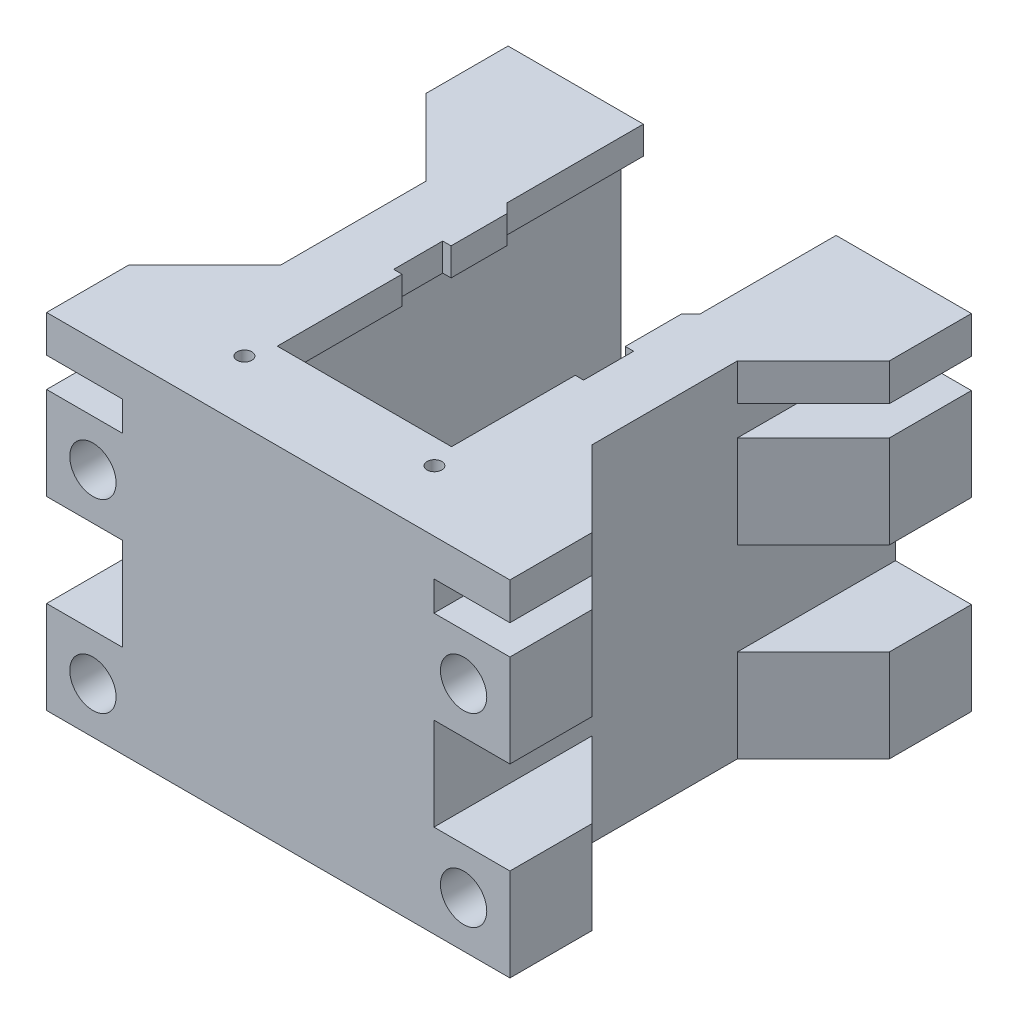
from build123d import *

# Parameters (mm, degrees)
SKETCH1_R                 = 0.8
BOSS_EXTRUDE2_DEPTH       = 2.4
BOSS_EXTRUDE4_DEPTH       = 34.2
BOSS_EXTRUDE7_OUTLINE_R   = 0.8
BOSS_EXTRUDE7_DEPTH       = 37.2
SKETCH1_10_R              = 0.8
CUT_EXTRUDE6_DEPTH        = 34.2
SKETCH1_11_R              = 0.8
BOSS_EXTRUDE8_DEPTH       = 2
BOSS_EXTRUDE9_START       = -49.8
BOSS_EXTRUDE9_OUTLINE_W   = 8.2
BOSS_EXTRUDE9_OUTLINE_H   = 10
BOSS_EXTRUDE9_OUTLINE_R   = 2.5
BOSS_EXTRUDE9_OUTLINE_H_2 = 4
BOSS_EXTRUDE9_DEPTH       = 49.8
BOSS_EXTRUDE10_START      = -44.4
SKETCH9_3_R               = 2.5
BOSS_EXTRUDE10_DEPTH      = 44.4
CUT_EXTRUDE7_START        = -5.4
SKETCH9_4_R               = 2.5
CUT_EXTRUDE7_DEPTH        = 5.4
CUT_EXTRUDE8_START        = -37.2
CUT_EXTRUDE8_DEPTH        = 37.2
BOSS_EXTRUDE12_START      = -3
BOSS_EXTRUDE12_DEPTH      = 3


# Read off the part's stored shape, not the designer's step: Boss-Extrude7, Boss-Extrude9
with BuildPart() as part:
    # Sketch1 → Boss-Extrude2 (new body)
    with BuildSketch(Plane(origin=(0, 0, 0), x_dir=(1, 0, 0), z_dir=(0, 1, 0))):
        Polygon((-10.4, 16.242178951), (-10.4, 30.95), (-16.8, 30.95), (-16.8, -18.85), (16.8, -18.85), (16.8, 30.95), (10.4, 30.95), (10.4, 16.242178951), (7.2, 13.042178951), (7.2, -14.85), (-7.2, -14.85), (-7.2, 13.042178951), align=None)
        with Locations(Location((-10.25, -8.45, 0), (0, 0, 270))):
            Circle(SKETCH1_R, mode=Mode.SUBTRACT)
        with Locations(Location((-10.25, 12.25, 0), (0, 0, 270))):
            Circle(SKETCH1_R, mode=Mode.SUBTRACT)
        with Locations(Location((-10.25, -12.25, 0), (0, 0, 270))):
            Circle(SKETCH1_R, mode=Mode.SUBTRACT)
        with Locations(Location((10.25, -8.45, 0), (0, 0, 270))):
            Circle(SKETCH1_R, mode=Mode.SUBTRACT)
        with Locations(Location((10.25, -12.25, 0), (0, 0, 270))):
            Circle(SKETCH1_R, mode=Mode.SUBTRACT)
        with Locations(Location((10.25, 12.25, 0), (0, 0, 270))):
            Circle(SKETCH1_R, mode=Mode.SUBTRACT)
    extrude(amount=BOSS_EXTRUDE2_DEPTH)

    # Sketch1<6> → Boss-Extrude4 (add)
    with BuildSketch(Plane(origin=(0, 0, 0), x_dir=(1, 0, 0), z_dir=(0, 1, 0))):
        Polygon((-12.8, -14.85), (-12.8, 30.95), (-16.8, 30.95), (-16.8, -18.85), (16.8, -18.85), (16.8, 30.95), (12.8, 30.95), (12.8, -14.85), align=None)
    extrude(amount=BOSS_EXTRUDE4_DEPTH)

    # Boss-Extrude7 outline → Boss-Extrude7 (add)
    with BuildSketch(Plane(origin=(0, 0, 0), x_dir=(1, 0, 0), z_dir=(0, 1, 0))):
        Polygon((16.8, -18.85), (16.8, 30.95), (10.4, 30.95), (10.4, 16.242178951), (9.4, 15.242178951), (9.4, 9.2), (10.3, 9.2), (10.3, 3.8), (9.4, 3.8), (9.4, -9.55), (-9.4, -9.55), (-9.4, 3.9), (-10.3, 3.9), (-10.3, 9.2), (-9.4, 9.2), (-9.4, 15.242178951), (-10.4, 16.242178951), (-10.4, 30.95), (-16.8, 30.95), (-16.8, -18.85), align=None)
        with Locations((-10.25, 12.25)):
            Circle(BOSS_EXTRUDE7_OUTLINE_R, mode=Mode.SUBTRACT)
        with Locations((-10.25, -12.25)):
            Circle(BOSS_EXTRUDE7_OUTLINE_R, mode=Mode.SUBTRACT)
        with Locations((10.25, 12.25)):
            Circle(BOSS_EXTRUDE7_OUTLINE_R, mode=Mode.SUBTRACT)
        with Locations((10.25, -12.25)):
            Circle(BOSS_EXTRUDE7_OUTLINE_R, mode=Mode.SUBTRACT)
    extrude(amount=BOSS_EXTRUDE7_DEPTH)

    # Sketch1<10> → Cut-Extrude6 (cut)
    with BuildSketch(Plane(origin=(0, 0, 0), x_dir=(1, 0, 0), z_dir=(0, 1, 0))):
        Polygon((-10.4, 16.242178951), (-10.4, 30.95), (-12.8, 30.95), (-12.8, -14.85), (12.8, -14.85), (12.8, 30.95), (10.4, 30.95), (10.4, 16.242178951), (7.2, 13.042178951), (7.2, -9.55), (-7.2, -9.55), (-7.2, 13.042178951), align=None)
        with Locations(Location((-10.25, 12.25, 0), (0, 0, 270))):
            Circle(SKETCH1_10_R, mode=Mode.SUBTRACT)
        with Locations(Location((-10.25, -12.25, 0), (0, 0, 270))):
            Circle(SKETCH1_10_R, mode=Mode.SUBTRACT)
        with Locations(Location((10.25, -12.25, 0), (0, 0, 270))):
            Circle(SKETCH1_10_R, mode=Mode.SUBTRACT)
        with Locations(Location((10.25, 12.25, 0), (0, 0, 270))):
            Circle(SKETCH1_10_R, mode=Mode.SUBTRACT)
    extrude(amount=CUT_EXTRUDE6_DEPTH, mode=Mode.SUBTRACT)

    # Sketch1<11> → Boss-Extrude8 (add)
    # profile 1 of 2: a face of its own
    with BuildSketch(Plane(origin=(0, 0, 0), x_dir=(1, 0, 0), z_dir=(0, 1, 0))):
        Polygon((-10.4, 16.242178951), (-10.4, 30.95), (-12.8, 30.95), (-12.8, -14.85), (-7.2, -14.85), (-7.2, 13.042178951), align=None)
        with Locations(Location((-10.25, -8.45, 0), (0, 0, 270))):
            Circle(SKETCH1_11_R, mode=Mode.SUBTRACT)
        with Locations(Location((-10.25, 12.25, 0), (0, 0, 270))):
            Circle(SKETCH1_11_R, mode=Mode.SUBTRACT)
    # profile 2 of 2: a face of its own
    with BuildSketch(Plane(origin=(0, 0, 0), x_dir=(1, 0, 0), z_dir=(0, 1, 0))):
        Polygon((7.2, -14.85), (12.8, -14.85), (12.8, 30.95), (10.4, 30.95), (10.4, 16.242178951), (7.2, 13.042178951), align=None)
        with Locations(Location((10.25, -8.45, 0), (0, 0, 270))):
            Circle(SKETCH1_11_R, mode=Mode.SUBTRACT)
        with Locations(Location((10.25, 12.25, 0), (0, 0, 270))):
            Circle(SKETCH1_11_R, mode=Mode.SUBTRACT)
    extrude(amount=BOSS_EXTRUDE8_DEPTH)

    # Boss-Extrude9 outline → Boss-Extrude9 (add)
    # profile 1 of 6: a face of its own
    with BuildSketch(Plane.XY.offset(18.85).offset(BOSS_EXTRUDE9_START)):
        with Locations((20.9, 5)):
            Rectangle(BOSS_EXTRUDE9_OUTLINE_W, BOSS_EXTRUDE9_OUTLINE_H)
        with Locations((20, 5)):
            Circle(BOSS_EXTRUDE9_OUTLINE_R, mode=Mode.SUBTRACT)
    # profile 2 of 6: a face of its own
    with BuildSketch(Plane.XY.offset(18.85).offset(BOSS_EXTRUDE9_START)):
        with Locations((-20.9, 5)):
            Rectangle(BOSS_EXTRUDE9_OUTLINE_W, BOSS_EXTRUDE9_OUTLINE_H)
        with Locations((-20, 5)):
            Circle(BOSS_EXTRUDE9_OUTLINE_R, mode=Mode.SUBTRACT)
    # profile 3 of 6: a face of its own
    with BuildSketch(Plane.XY.offset(18.85).offset(BOSS_EXTRUDE9_START)):
        with Locations((20.9, 25)):
            Rectangle(BOSS_EXTRUDE9_OUTLINE_W, BOSS_EXTRUDE9_OUTLINE_H)
        with Locations((20, 25)):
            Circle(BOSS_EXTRUDE9_OUTLINE_R, mode=Mode.SUBTRACT)
    # profile 4 of 6: a face of its own
    with BuildSketch(Plane.XY.offset(18.85).offset(BOSS_EXTRUDE9_START)):
        with Locations((-20.9, 25)):
            Rectangle(BOSS_EXTRUDE9_OUTLINE_W, BOSS_EXTRUDE9_OUTLINE_H)
        with Locations((-20, 25)):
            Circle(BOSS_EXTRUDE9_OUTLINE_R, mode=Mode.SUBTRACT)
    # profile 5 of 6: a face of its own
    with BuildSketch(Plane.XY.offset(18.85).offset(BOSS_EXTRUDE9_START)):
        with Locations((20.9, 35.2)):
            Rectangle(BOSS_EXTRUDE9_OUTLINE_W, BOSS_EXTRUDE9_OUTLINE_H_2)
    # profile 6 of 6: a face of its own
    with BuildSketch(Plane.XY.offset(18.85).offset(BOSS_EXTRUDE9_START)):
        with Locations((-20.9, 35.2)):
            Rectangle(BOSS_EXTRUDE9_OUTLINE_W, BOSS_EXTRUDE9_OUTLINE_H_2)
    extrude(amount=BOSS_EXTRUDE9_DEPTH)

    # Sketch9<3> → Boss-Extrude10 (add)
    with BuildSketch(Plane.XY.offset(18.85).offset(BOSS_EXTRUDE10_START)):
        with Locations((-20, 25)):
            Circle(SKETCH9_3_R)
        with Locations((-20, 5)):
            Circle(SKETCH9_3_R)
        with Locations((20, 5)):
            Circle(SKETCH9_3_R)
        with Locations((20, 25)):
            Circle(SKETCH9_3_R)
    extrude(amount=BOSS_EXTRUDE10_DEPTH)

    # Sketch9<4> → Cut-Extrude7 (cut)
    with BuildSketch(Plane.XY.offset(18.85).offset(CUT_EXTRUDE7_START)):
        with Locations((-20, 25)):
            Circle(SKETCH9_4_R)
        with Locations((-20, 5)):
            Circle(SKETCH9_4_R)
        with Locations((20, 5)):
            Circle(SKETCH9_4_R)
        with Locations((20, 25)):
            Circle(SKETCH9_4_R)
    extrude(amount=CUT_EXTRUDE7_DEPTH, mode=Mode.SUBTRACT)

    # Sketch12 → Cut-Extrude8 (cut)
    with BuildSketch(Plane(origin=(0, 37.2, 0), x_dir=(1, 0, 0), z_dir=(0, 1, 0)).offset(CUT_EXTRUDE8_START)):
        Polygon((-16.8, 13.896914247), (-25, 22.096914247), (-25, -9.996914247), (-16.8, -1.796914247), align=None)
        Polygon((16.8, -1.796914247), (25, -9.996914247), (25, 22.096914247), (16.8, 13.896914247), align=None)
    extrude(amount=CUT_EXTRUDE8_DEPTH, mode=Mode.SUBTRACT)

    # Sketch14 → Boss-Extrude12 (add)
    with BuildSketch(Plane(origin=(0, 37.2, 0), x_dir=(1, 0, 0), z_dir=(0, 1, 0)).offset(BOSS_EXTRUDE12_START)):
        with BuildLine():
            ThreePointArc((-10.3, 13.048435971), (-11.05, 12.25), (-10.3, 11.451564029))
            Line((-10.3, 11.451564029), (-10.3, 13.048435971))
        make_face()
        with BuildLine():
            Line((-10.3, 13.048435971), (-10.3, 11.451564029))
            ThreePointArc((-10.3, 11.451564029), (-9.702277442, 11.666904811), (-9.45, 12.25))
            ThreePointArc((-9.45, 12.25), (-9.702277442, 12.833095189), (-10.3, 13.048435971))
        make_face()
        with BuildLine():
            ThreePointArc((10.3, 13.048435971), (9.45, 12.25), (10.3, 11.451564029))
            Line((10.3, 11.451564029), (10.3, 13.048435971))
        make_face()
        with BuildLine():
            Line((10.3, 13.048435971), (10.3, 11.451564029))
            ThreePointArc((10.3, 11.451564029), (10.833095189, 11.702277442), (11.05, 12.25))
            ThreePointArc((11.05, 12.25), (10.833095189, 12.797722558), (10.3, 13.048435971))
        make_face()
    extrude(amount=BOSS_EXTRUDE12_DEPTH)


solid = part.part
